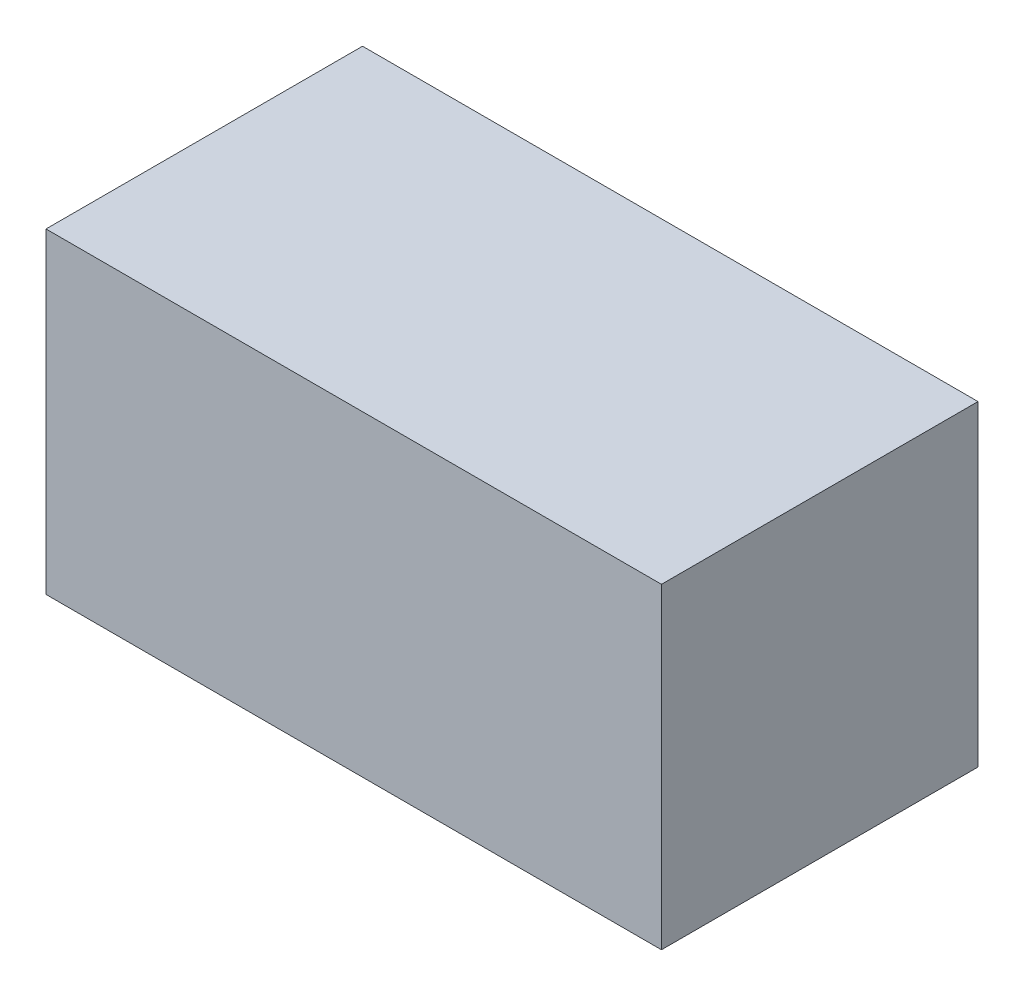
from build123d import *

# Parameters (mm, degrees)
SKETCH_1_W      = 70
SKETCH_1_H      = 36
EXTRUDE_1_DEPTH = 18


with BuildPart() as part:
    # 草图1 → 凸台-拉伸1 (new, symmetric)
    with BuildSketch(Plane.XY):
        Rectangle(SKETCH_1_W, SKETCH_1_H)
    extrude(amount=EXTRUDE_1_DEPTH, both=True)


solid = part.part
